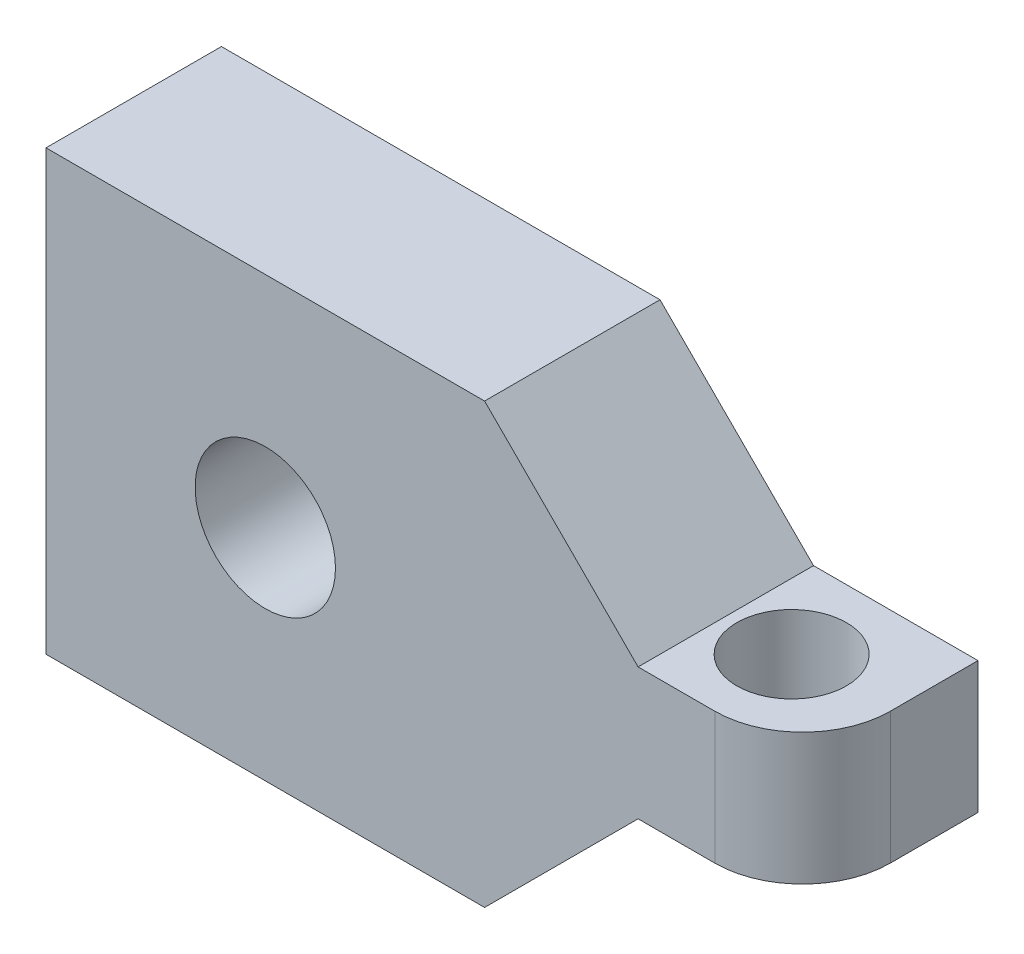
from build123d import *

# Parameters (mm, degrees)
SKETCH1_W           = 10
SKETCH1_H           = 20
BOSS_EXTRUDE1_DEPTH = 4
SKETCH2_R           = 1.6
CUT_EXTRUDE1_DEPTH  = 12.874342087
SKETCH3_R           = 1.25
CUT_EXTRUDE2_DEPTH  = 15.696938457
SKETCH4_W           = 2.75
SKETCH4_H           = 10
CUT_EXTRUDE3_DEPTH  = 12.874342087
SKETCH5_W           = 7.25
SKETCH5_H           = 3.5
CUT_EXTRUDE4_DEPTH  = 12.874342087
CHAMFER1_SIZE       = 3.5
FILLET1_R           = 2


with BuildPart() as part:
    # Sketch1 → Boss-Extrude1 (new body)
    with BuildSketch(Plane(origin=(0, 0, 0), x_dir=(0, 1, 0), z_dir=(0, 0, 1))):
        Rectangle(SKETCH1_W, SKETCH1_H)
    extrude(amount=BOSS_EXTRUDE1_DEPTH)

    # Sketch2 → Cut-Extrude1 (cut, through all)
    with BuildSketch(Plane.XY.offset(4)):
        with Locations((-5, 0)):
            Circle(SKETCH2_R)
    extrude(amount=-CUT_EXTRUDE1_DEPTH, mode=Mode.SUBTRACT)

    # Sketch3 → Cut-Extrude2 (cut, through all)
    with BuildSketch(Plane.XZ.offset(5)):
        with Locations((5, 2)):
            Circle(SKETCH3_R)
    extrude(amount=-CUT_EXTRUDE2_DEPTH, mode=Mode.SUBTRACT)

    # Sketch4 → Cut-Extrude3 (cut, through all)
    with BuildSketch(Plane.XY.offset(4)):
        with Locations((8.625, 0)):
            Rectangle(SKETCH4_W, SKETCH4_H)
    extrude(amount=-CUT_EXTRUDE3_DEPTH, mode=Mode.SUBTRACT)

    # Sketch5 → Cut-Extrude4 (cut, through all)
    with BuildSketch(Plane.XY.offset(4)):
        with Locations((3.625, 3.25)):
            Rectangle(SKETCH5_W, SKETCH5_H)
        with Locations((3.625, -3.25)):
            Rectangle(SKETCH5_W, SKETCH5_H)
    extrude(amount=-CUT_EXTRUDE4_DEPTH, mode=Mode.SUBTRACT)

    # Chamfer1
    chamfer1_edges = [part.edges().sort_by_distance(p)[0] for p in [
        (0, 1.5, 2),
        (0, -1.5, 2),
    ]]
    chamfer(chamfer1_edges, length=CHAMFER1_SIZE - 0.0001)  # a hair under: the kernel refuses the full size

    # Fillet1
    fillet1_edges = [part.edges().sort_by_distance(p)[0] for p in [
        (7.25, 0, 4),
    ]]
    fillet(fillet1_edges, radius=FILLET1_R)


solid = part.part
